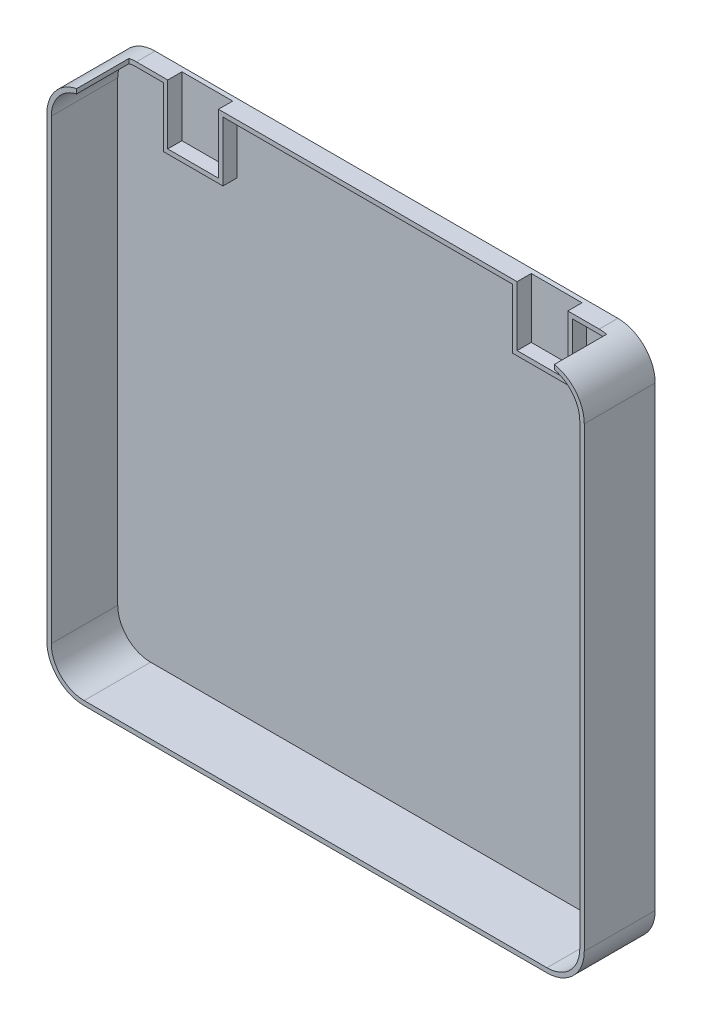
from build123d import *

# Parameters (mm, degrees)
ESQUISSE1_W             = 360
ESQUISSE1_H             = 356
BOSS_EXTRU_1_DEPTH      = 47.5
CONG_1_R                = 25
ENL_V_MAT_EXTRU_1_DEPTH = 44.5
ESQUISSE3_W             = 320
ESQUISSE3_H             = 35
ENL_V_MAT_EXTRU_2_DEPTH = 10
ESQUISSE5_W             = 40
ESQUISSE5_H             = 40
ESQUISSE5_W_2           = 34
ESQUISSE5_H_2           = 34
EXTRU_MINCE1_DEPTH      = 9.5
ESQUISSE10_W            = 34
ESQUISSE10_H            = 9.5
ENL_V_MAT_EXTRU_4_DEPTH = 10
ESQUISSE13_W            = 34
ESQUISSE13_H            = 9.5
ENL_V_MAT_EXTRU_5_DEPTH = 10


with BuildPart() as part:
    # Esquisse1 → Boss.-Extru.1 (new body)
    with BuildSketch(Plane.XY):
        with Locations((180, 178)):
            Rectangle(ESQUISSE1_W, ESQUISSE1_H)
    extrude(amount=BOSS_EXTRU_1_DEPTH)

    # Congé1
    cong_1_edges = [part.edges().sort_by_distance(p)[0] for p in [
        (0, 0, 23.75),
        (360, 0, 23.75),
        (360, 356, 23.75),
        (0, 356, 23.75),
    ]]
    fillet(cong_1_edges, radius=CONG_1_R)

    # Esquisse2 → Enlèv. mat.-Extru.1 (cut)
    with BuildSketch(Plane.XY.offset(47.5)):
        with BuildLine():
            Line((3, 331), (3, 25))
            ThreePointArc((3, 25), (9.443650814, 9.443650814), (25, 3))
            Line((25, 3), (335, 3))
            ThreePointArc((335, 3), (350.556349186, 9.443650814), (357, 25))
            Line((357, 25), (357, 331))
            ThreePointArc((357, 331), (350.556349186, 346.556349186), (335, 353))
            Line((335, 353), (25, 353))
            ThreePointArc((25, 353), (9.443650814, 346.556349186), (3, 331))
        make_face()
    extrude(amount=-ENL_V_MAT_EXTRU_1_DEPTH, mode=Mode.SUBTRACT)

    # Esquisse3 → Enlèv. mat.-Extru.2 (cut)
    with BuildSketch(Plane(origin=(0, 356, 0), x_dir=(1, 0, 0), z_dir=(0, 1, 0))):
        with Locations((180, -30)):
            Rectangle(ESQUISSE3_W, ESQUISSE3_H)
    extrude(amount=-ENL_V_MAT_EXTRU_2_DEPTH, mode=Mode.SUBTRACT)

    # Esquisse5 → Extru.-Mince1 (add)
    # profile 1 of 2: a face of its own
    with BuildSketch(Plane.XY.offset(3)):
        with Locations((63, 333)):
            Rectangle(ESQUISSE5_W, ESQUISSE5_H)
        with Locations((63, 333)):
            Rectangle(ESQUISSE5_W_2, ESQUISSE5_H_2, mode=Mode.SUBTRACT)
    # profile 2 of 2: a face of its own
    with BuildSketch(Plane.XY.offset(3)):
        with Locations((297, 333)):
            Rectangle(ESQUISSE5_W, ESQUISSE5_H)
        with Locations((297, 333)):
            Rectangle(ESQUISSE5_W_2, ESQUISSE5_H_2, mode=Mode.SUBTRACT)
    extrude(amount=EXTRU_MINCE1_DEPTH)

    # Esquisse10 → Enlèv. mat.-Extru.4 (cut)
    with BuildSketch(Plane(origin=(0, 356, 0), x_dir=(1, 0, 0), z_dir=(0, 1, 0))):
        with Locations((297, -7.75)):
            Rectangle(ESQUISSE10_W, ESQUISSE10_H)
    extrude(amount=-ENL_V_MAT_EXTRU_4_DEPTH, mode=Mode.SUBTRACT)

    # Esquisse13 → Enlèv. mat.-Extru.5 (cut)
    with BuildSketch(Plane(origin=(0, 356, 0), x_dir=(1, 0, 0), z_dir=(0, 1, 0))):
        with Locations((63, -7.75)):
            Rectangle(ESQUISSE13_W, ESQUISSE13_H)
    extrude(amount=-ENL_V_MAT_EXTRU_5_DEPTH, mode=Mode.SUBTRACT)


solid = part.part
